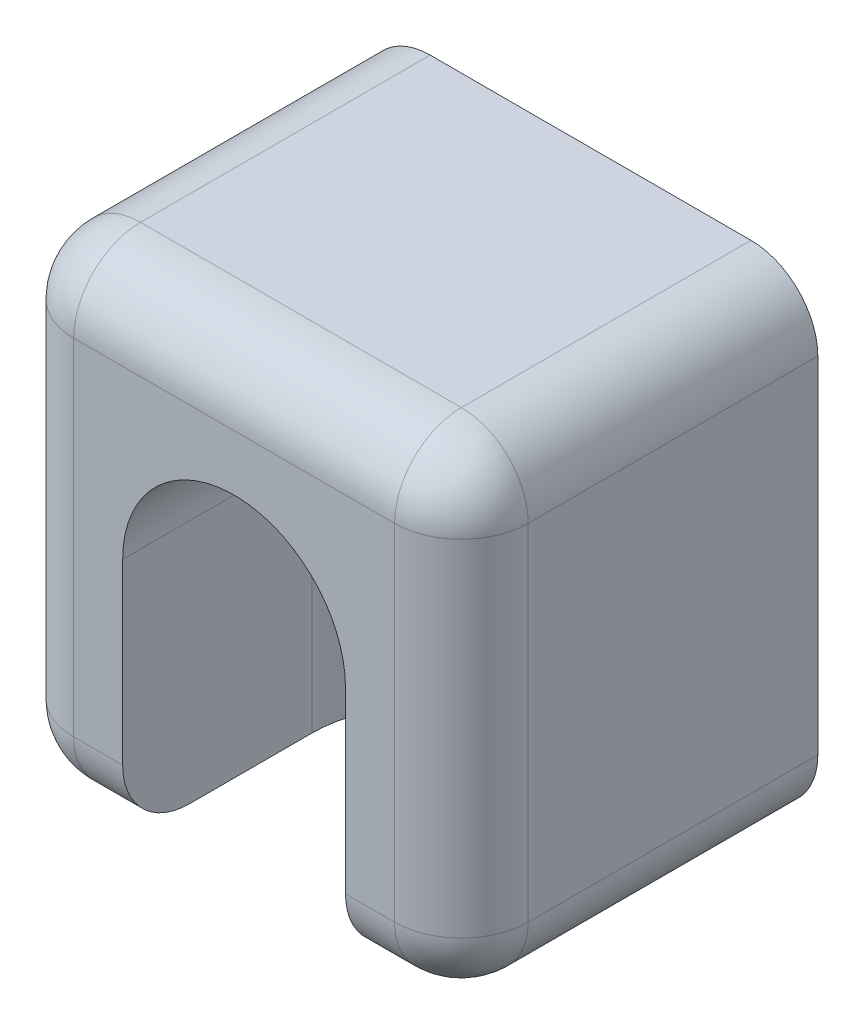
from build123d import *

# Parameters (mm, degrees)
SKETCH1_W      = 20.4
SKETCH1_H      = 21.5
EXTRUDE1_DEPTH = 16
FILLET8_R      = 3
SKETCH2_W      = 14.5
SKETCH2_H      = 17
EXTRUDE2_DEPTH = 5
FILLET9_R      = 5
FILLET10_R     = 5


# Some blends are built 0.0001 mm under size
with BuildPart() as part:
    # Sketch1 → Extrude1 (new body)
    with BuildSketch(Plane.XY):
        with Locations((10.2, 10.75)):
            Rectangle(SKETCH1_W, SKETCH1_H)
    extrude(amount=-EXTRUDE1_DEPTH)

    # Fillet8
    fillet8_edges = [part.edges().sort_by_distance(p)[0] for p in [
        (10.2, 21.5, 0),
        (20.4, 10.75, 0),
        (10.2, 0, 0),
        (0, 10.75, 0),
        (0, 21.5, -8),
        (20.4, 21.5, -8),
        (20.4, 0, -8),
        (0, 0, -8),
    ]]
    fillet(fillet8_edges, radius=FILLET8_R)

    # Sketch2 → Extrude2 (cut, symmetric)
    with BuildSketch(Plane(origin=(10.2, 0, 0), x_dir=(0, 0, -1), z_dir=(1, 0, 0))):
        with Locations((6.25, 7.5)):
            Rectangle(SKETCH2_W, SKETCH2_H)
    extrude(amount=EXTRUDE2_DEPTH, both=True, mode=Mode.SUBTRACT)

    # Fillet9
    fillet9_edges = [part.edges().sort_by_distance(p)[0] for p in [
        (5.2, 16, -6.75),
        (15.2, 16, -6.75),
    ]]
    fillet(fillet9_edges, radius=FILLET9_R - 0.0001)  # a hair under: the kernel refuses the full size

    # Fillet10
    # the kernel refuses this fillet: 5 mm, written as the material it adds along each edge
    with BuildSketch(Plane(origin=(5.2, 23.5001, -13.5), x_dir=(0, 0, 1), z_dir=(0, -1, 0))) as fillet10_piece_1_section:
        with BuildLine():
            CenterArc((FILLET10_R, -FILLET10_R), FILLET10_R, 90, 90)
            Line((0, -FILLET10_R), (0, 0))
            Line((0, 0), (FILLET10_R, 0))
        make_face()
    fillet10_piece_1 = extrude(amount=23.5001, mode=Mode.PRIVATE)
    fillet10_piece_1 = split(fillet10_piece_1, bisect_by=Plane(origin=(6.690730553, 21.5, -12.634344102), z_dir=(0, -1, 0)), keep=Keep.TOP, mode=Mode.PRIVATE)
    add(fillet10_piece_1)
    with BuildSketch(Plane(origin=(15.2, 23.5001, -13.5), x_dir=(-1, 0, 0), z_dir=(0, -1, 0))) as fillet10_piece_2_section:
        with BuildLine():
            CenterArc((FILLET10_R, -FILLET10_R), FILLET10_R, 90, 90)
            Line((0, -FILLET10_R), (0, 0))
            Line((0, 0), (FILLET10_R, 0))
        make_face()
    fillet10_piece_2 = extrude(amount=23.5001, mode=Mode.PRIVATE)
    fillet10_piece_2 = split(fillet10_piece_2, bisect_by=Plane(origin=(13.709267183, 21.5, -12.634319822), z_dir=(0, -1, 0)), keep=Keep.TOP, mode=Mode.PRIVATE)
    add(fillet10_piece_2)


solid = part.part
